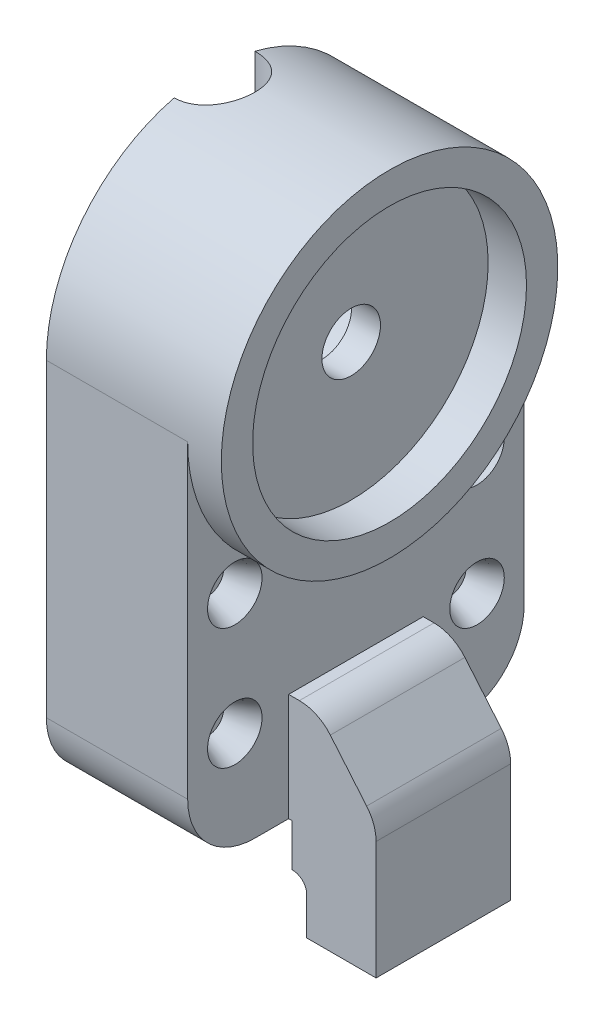
from build123d import *
from build123d.topology import SkipClean

# Parameters (mm, degrees)
CROQUIS1_W                       = 10.5
CROQUIS1_H                       = 25
SALIENTE_EXTRUIR1_DEPTH          = 28
CROQUIS2_R                       = 12.5
SALIENTE_EXTRUIR2_DEPTH          = 13
REDONDEO1_START                  = -1
REDONDEO1_DEPTH                  = 12
CORTAR_EXTRUIR1_DEPTH            = 13
CROQUIS5_R                       = 9.915
CORTAR_EXTRUIR2_DEPTH            = 8
CROQUIS8_R                       = 1.175
CORTAR_EXTRUIR5_DEPTH            = 50.338119296
CROQUIS10_W                      = 6.5
CROQUIS10_H                      = 15
SALIENTE_EXTRUIR3_DEPTH          = 5
CORTAR_EXTRUIR6_DEPTH            = 7
CORTAR_EXTRUIR7_DEPTH            = 3.85
CHAFL_N1_SIZE                    = 4.3
CHAFL_N1_SIZE2                   = 5.124540448
REDONDEO2_R                      = 1
REDONDEO3_R                      = 3
CORTAR_EXTRUIR8_START            = -2.5
CORTAR_EXTRUIR8_DEPTH            = 2.5
CROQUIS14_R                      = 3.6
CORTAR_EXTRUIR9_DEPTH            = 49.739101502
CROQUIS15_R                      = 2.025
CORTAR_EXTRUIR10_DEPTH           = 2
CORTAR_EXTRUIR10_DRAFT           = -23
CORTAR_EXTRUIR10_PROFILE_2_DEPTH = 2
CORTAR_EXTRUIR10_PROFILE_2_DRAFT = -23
CORTAR_EXTRUIR10_PROFILE_3_DEPTH = 2
CORTAR_EXTRUIR10_PROFILE_3_DRAFT = -23
CORTAR_EXTRUIR10_PROFILE_4_DEPTH = 2
CORTAR_EXTRUIR10_PROFILE_4_DRAFT = -23
CROQUIS16_R                      = 3.6
SALIENTE_EXTRUIR4_DEPTH          = 2.5
CROQUIS17_R                      = 12.5
SALIENTE_EXTRUIR5_DEPTH          = 2.5
CROQUIS18_R                      = 2.175
CORTAR_EXTRUIR11_DEPTH           = 50.338119296
CROQUIS19_R                      = 10.175
CORTAR_EXTRUIR12_DEPTH           = 2.85


with BuildPart() as part:
    # Croquis1 → Saliente-Extruir1 (new body)
    with BuildSketch(Plane(origin=(0, 0, 0), x_dir=(1, 0, 0), z_dir=(0, 1, 0))):
        with Locations((5.25, 12.5)):
            Rectangle(CROQUIS1_W, CROQUIS1_H)
    extrude(amount=SALIENTE_EXTRUIR1_DEPTH)

    # Croquis2 → Saliente-Extruir2 (add)
    with BuildSketch(Plane.ZY):
        with Locations((-12.5, 28)):
            Circle(CROQUIS2_R)
    extrude(amount=-SALIENTE_EXTRUIR2_DEPTH)

    # Croquis3 → Cortar-Revolución1 (revolve, cut)
    with BuildSketch(Plane.ZY):
        Polygon((-4, 0.5), (-4, 4), (-6, 4), (-6, 10), (-4, 10), (-4, 15), (-9.5, 15), (-9.5, 41), (-12.5, 41), (-12.5, 0), (-4, 0), align=None)
    revolve(axis=Axis((0, 0, -12.5), (0, 1, 0)), mode=Mode.SUBTRACT)

    # Redondeo1: read off the stored shape, not the designer's step
    # Redondeo1 outline → Redondeo1 (cut)
    with BuildSketch(Plane.YZ.offset(REDONDEO1_START)):
        with BuildLine():
            Line((0, 0), (0, -5))
            ThreePointArc((0, -5), (1.464466094, -1.464466094), (5, 0))
            Line((5, 0), (0, 0))
        make_face()
        with BuildLine():
            ThreePointArc((5, -25), (1.464466094, -23.535533906), (0, -20))
            Line((0, -20), (0, -25))
            Line((0, -25), (5, -25))
        make_face()
    extrude(amount=REDONDEO1_DEPTH, mode=Mode.SUBTRACT)

    # Croquis4 → Cortar-Extruir1 (cut)
    with BuildSketch(Plane.XZ.offset(-15)):
        Polygon((0, -18.67764788), (5.35, -15.58882394), (5.35, -9.41117606), (0, -6.32235212), (-5.35, -9.41117606), (-5.35, -15.58882394), align=None)
    extrude(amount=-CORTAR_EXTRUIR1_DEPTH, mode=Mode.SUBTRACT)

    # Croquis5 → Cortar-Extruir2 (cut)
    with BuildSketch(Plane.ZY):
        with Locations((-12.5, 28)):
            Circle(CROQUIS5_R)
    extrude(amount=-CORTAR_EXTRUIR2_DEPTH, mode=Mode.SUBTRACT)

    # Croquis8 → Cortar-Extruir5 (cut, through all)
    with BuildSketch(Plane.ZY):
        with Locations((-21.5, 16.5)):
            Circle(CROQUIS8_R)
        with Locations((-3.5, 16.5)):
            Circle(CROQUIS8_R)
        with Locations((-3.5, 7.5)):
            Circle(CROQUIS8_R)
        with Locations((-21.5, 7.5)):
            Circle(CROQUIS8_R)
    extrude(amount=-CORTAR_EXTRUIR5_DEPTH, mode=Mode.SUBTRACT)

    # Croquis10 → Saliente-Extruir3 (add, symmetric)
    with BuildSketch(Plane.XY.offset(-12.5)):
        with Locations((13.75, 0.5)):
            Rectangle(CROQUIS10_W, CROQUIS10_H)
    extrude(amount=SALIENTE_EXTRUIR3_DEPTH, both=True)

    # Croquis11 → Cortar-Extruir6 (cut)
    with BuildSketch(Plane.XZ.offset(7)):
        with BuildLine():
            Line((10.5, -17.5), (10.743486399, -17.5))
            ThreePointArc((10.743486399, -17.5), (11.85, -12.5), (10.743486399, -7.5))
            Line((10.743486399, -7.5), (10.5, -7.5))
            Line((10.5, -7.5), (10.5, -17.5))
        make_face()
    extrude(amount=-CORTAR_EXTRUIR6_DEPTH, mode=Mode.SUBTRACT)

    # Croquis12 → Cortar-Extruir7 (cut)
    with BuildSketch(Plane.XZ.offset(7)):
        with BuildLine():
            ThreePointArc((10.743486399, -7.5), (11.85, -12.5), (10.743486399, -17.5))
            Line((10.743486399, -17.5), (13.787722048, -17.5))
            Line((13.787722048, -17.5), (12.6958, -10.515267686))
            ThreePointArc((12.6958, -10.515267686), (12.358868803, -8.981355103), (11.837335004, -7.5))
            Line((11.837335004, -7.5), (10.743486399, -7.5))
        make_face()
    extrude(amount=-CORTAR_EXTRUIR7_DEPTH, mode=Mode.SUBTRACT)

    # Chaflán1
    chafl_n1_edges = [part.edges().sort_by_distance(p)[0] for p in [
        (17, 8, -12.5),
    ]]
    chafl_n1_side = [part.faces().sort_by_distance(p)[0] for p in [
        (13.75, 8, -12.5),
    ]]
    chamfer(chafl_n1_edges, length=CHAFL_N1_SIZE, length2=CHAFL_N1_SIZE2, reference=chafl_n1_side[0])

    # Redondeo2
    redondeo2_edges = [part.edges().sort_by_distance(p)[0] for p in [
        (12.358868803, -3.15, -8.981355103),
        (13.241761024, -3.15, -14.007633843),
    ]]
    fillet(redondeo2_edges, radius=REDONDEO2_R - 0.0001)  # a hair under: the kernel refuses the full size

    # Redondeo3
    redondeo3_edges = [part.edges().sort_by_distance(p)[0] for p in [
        (12.7, 8, -12.5),
        (17, 2.875459552, -12.5),
    ]]
    fillet(redondeo3_edges, radius=REDONDEO3_R)

    # Croquis13 → Cortar-Extruir8 (cut)
    with BuildSketch(Plane(origin=(13, 0, 0), x_dir=(0, 0, -1), z_dir=(1, 0, 0)).offset(CORTAR_EXTRUIR8_START)):
        with BuildLine():
            ThreePointArc((9.860236176, 30.44778409), (8.9, 28), (9.860236176, 25.55221591))
            Line((9.860236176, 25.55221591), (10.393008213, 15.678856157))
            ThreePointArc((10.393008213, 15.678856157), (12.51082596, 15.500004688), (14.628330733, 15.682524273))
            Line((14.628330733, 15.682524273), (15.272384177, 25.703505721))
            ThreePointArc((15.272384177, 25.703505721), (16.1, 28), (15.272384177, 30.296494279))
            Line((15.272384177, 30.296494279), (14.628330733, 40.317475727))
            ThreePointArc((14.628330733, 40.317475727), (12.51082596, 40.499995312), (10.393008213, 40.321143843))
            Line((10.393008213, 40.321143843), (9.860236176, 30.44778409))
        make_face()
    extrude(amount=CORTAR_EXTRUIR8_DEPTH, mode=Mode.SUBTRACT)

    # Croquis14 → Cortar-Extruir9 (cut, through all)
    with SkipClean():  # the faces are left unmerged after this step: merging them gives an invalid solid
        with BuildSketch(Plane(origin=(10.5, 0, 0), x_dir=(0, 0, -1), z_dir=(1, 0, 0))):
            with Locations(Location((12.5, 28, 0), (0, 0, 39.636527191))):
                Circle(CROQUIS14_R)
        extrude(amount=-CORTAR_EXTRUIR9_DEPTH, mode=Mode.SUBTRACT)


with BuildPart() as cortar_extruir10_tool:
    # Croquis15 → Cortar-Extruir10 (with draft: the straight prism first)
    with BuildSketch(Plane(origin=(10.5, 0, 0), x_dir=(0, 0, -1), z_dir=(1, 0, 0))):
        with Locations((3.5, 16.5)):
            Circle(CROQUIS15_R)
    extrude(amount=-CORTAR_EXTRUIR10_DEPTH)
    # Cortar-Extruir10: the draft: its side faces are tilted about the plane it starts from
    cortar_extruir10_sides = [cortar_extruir10_tool.faces().sort_by_distance(p)[0] for p in [
        (9.5, 16.5, -1.475),
    ]]
    draft(cortar_extruir10_sides, Plane(origin=(10.5, 0, 0), x_dir=(0, 0, -1), z_dir=(1, 0, 0)), CORTAR_EXTRUIR10_DRAFT)


with BuildPart() as part_1:
    add(part.part)

    # Cortar-Extruir10: cut by cortar_extruir10_tool
    add(cortar_extruir10_tool.part, mode=Mode.SUBTRACT)


with BuildPart() as cortar_extruir10_profile_2_tool:
    # Croquis15 → Cortar-Extruir10 profile 2 (with draft: the straight prism first)
    with BuildSketch(Plane(origin=(10.5, 0, 0), x_dir=(0, 0, -1), z_dir=(1, 0, 0))):
        with Locations((3.5, 7.5)):
            Circle(CROQUIS15_R)
    extrude(amount=-CORTAR_EXTRUIR10_PROFILE_2_DEPTH)
    # Cortar-Extruir10 profile 2: the draft: its side faces are tilted about the plane it starts from
    cortar_extruir10_profile_2_sides = [cortar_extruir10_profile_2_tool.faces().sort_by_distance(p)[0] for p in [
        (9.5, 7.5, -1.475),
    ]]
    draft(cortar_extruir10_profile_2_sides, Plane(origin=(10.5, 0, 0), x_dir=(0, 0, -1), z_dir=(1, 0, 0)), CORTAR_EXTRUIR10_PROFILE_2_DRAFT)


with BuildPart() as part_2:
    add(part_1.part)

    # Cortar-Extruir10 profile 2: cut by cortar_extruir10_profile_2_tool
    add(cortar_extruir10_profile_2_tool.part, mode=Mode.SUBTRACT)


with BuildPart() as cortar_extruir10_profile_3_tool:
    # Croquis15 → Cortar-Extruir10 profile 3 (with draft: the straight prism first)
    with BuildSketch(Plane(origin=(10.5, 0, 0), x_dir=(0, 0, -1), z_dir=(1, 0, 0))):
        with Locations((21.5, 7.5)):
            Circle(CROQUIS15_R)
    extrude(amount=-CORTAR_EXTRUIR10_PROFILE_3_DEPTH)
    # Cortar-Extruir10 profile 3: the draft: its side faces are tilted about the plane it starts from
    cortar_extruir10_profile_3_sides = [cortar_extruir10_profile_3_tool.faces().sort_by_distance(p)[0] for p in [
        (9.5, 7.5, -19.475),
    ]]
    draft(cortar_extruir10_profile_3_sides, Plane(origin=(10.5, 0, 0), x_dir=(0, 0, -1), z_dir=(1, 0, 0)), CORTAR_EXTRUIR10_PROFILE_3_DRAFT)


with BuildPart() as part_3:
    add(part_2.part)

    # Cortar-Extruir10 profile 3: cut by cortar_extruir10_profile_3_tool
    add(cortar_extruir10_profile_3_tool.part, mode=Mode.SUBTRACT)


with BuildPart() as cortar_extruir10_profile_4_tool:
    # Croquis15 → Cortar-Extruir10 profile 4 (with draft: the straight prism first)
    with BuildSketch(Plane(origin=(10.5, 0, 0), x_dir=(0, 0, -1), z_dir=(1, 0, 0))):
        with Locations((21.5, 16.5)):
            Circle(CROQUIS15_R)
    extrude(amount=-CORTAR_EXTRUIR10_PROFILE_4_DEPTH)
    # Cortar-Extruir10 profile 4: the draft: its side faces are tilted about the plane it starts from
    cortar_extruir10_profile_4_sides = [cortar_extruir10_profile_4_tool.faces().sort_by_distance(p)[0] for p in [
        (9.5, 16.5, -19.475),
    ]]
    draft(cortar_extruir10_profile_4_sides, Plane(origin=(10.5, 0, 0), x_dir=(0, 0, -1), z_dir=(1, 0, 0)), CORTAR_EXTRUIR10_PROFILE_4_DRAFT)


with BuildPart() as part_4:
    add(part_3.part)

    # Cortar-Extruir10 profile 4: cut by cortar_extruir10_profile_4_tool
    add(cortar_extruir10_profile_4_tool.part, mode=Mode.SUBTRACT)

    # Croquis16 → Saliente-Extruir4 (add)
    with BuildSketch(Plane.ZY.offset(-8)):
        with Locations((-12.5, 28)):
            Circle(CROQUIS16_R)
    extrude(amount=-SALIENTE_EXTRUIR4_DEPTH)

    # Croquis17 → Saliente-Extruir5 (add)
    with BuildSketch(Plane(origin=(10.5, 0, 0), x_dir=(0, 0, -1), z_dir=(1, 0, 0))):
        with Locations(Location((12.5, 28, 0), (0, 0, 180))):
            Circle(CROQUIS17_R)
    extrude(amount=SALIENTE_EXTRUIR5_DEPTH)

    # Croquis18 → Cortar-Extruir11 (cut, through all)
    with BuildSketch(Plane(origin=(13, 0, 0), x_dir=(0, 0, -1), z_dir=(1, 0, 0))):
        with Locations((12.5, 28)):
            Circle(CROQUIS18_R)
    extrude(amount=-CORTAR_EXTRUIR11_DEPTH, mode=Mode.SUBTRACT)

    # Croquis19 → Cortar-Extruir12 (cut)
    with BuildSketch(Plane(origin=(13, 0, 0), x_dir=(0, 0, -1), z_dir=(1, 0, 0))):
        with Locations((12.5, 28)):
            Circle(CROQUIS19_R)
    extrude(amount=-CORTAR_EXTRUIR12_DEPTH, mode=Mode.SUBTRACT)


solid = part_4.part
